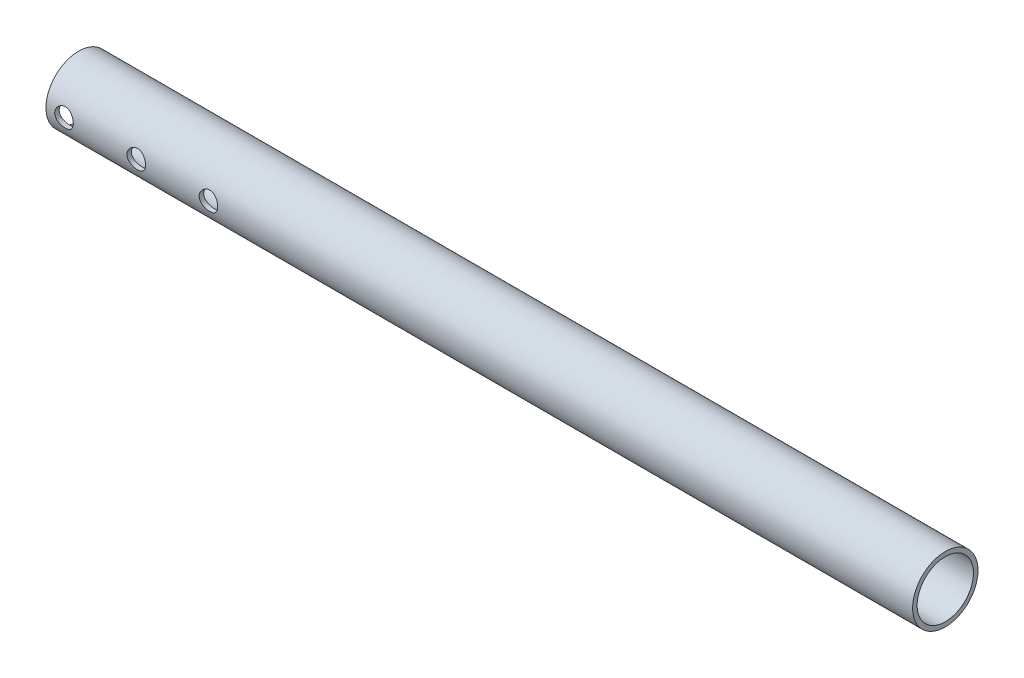
from build123d import *

# Parameters (mm, degrees)
SKETCH1_R               = 11.5
SKETCH1_R_2             = 9.9125
BOSS_EXTRUDE1_DEPTH     = 304.8
CUT_EXTRUDE1_DEPTH      = 306.773674472
CUT_EXTRUDE1_DEPTH_BACK = 306.773674472
SKETCH2_R               = 3.2639


with BuildPart() as part:
    # Sketch1 → Boss-Extrude1 (new body)
    with BuildSketch(Plane(origin=(0, 0, 0), x_dir=(0, 0, -1), z_dir=(1, 0, 0))):
        Circle(SKETCH1_R)
        Circle(SKETCH1_R_2, mode=Mode.SUBTRACT)
    extrude(amount=BOSS_EXTRUDE1_DEPTH)

    # Sketch2 → Cut-Extrude1 (cut, two sides: drawn at the far end of the back side and taken through both)
    with BuildSketch(Plane.XY.offset(10).offset(-CUT_EXTRUDE1_DEPTH_BACK)):
        with Locations((6.35, 0)):
            Circle(SKETCH2_R)
        with Locations((31.75, 0)):
            Circle(SKETCH2_R)
        with Locations((57.15, 0)):
            Circle(SKETCH2_R)
    extrude(amount=CUT_EXTRUDE1_DEPTH + CUT_EXTRUDE1_DEPTH_BACK, mode=Mode.SUBTRACT)


solid = part.part
